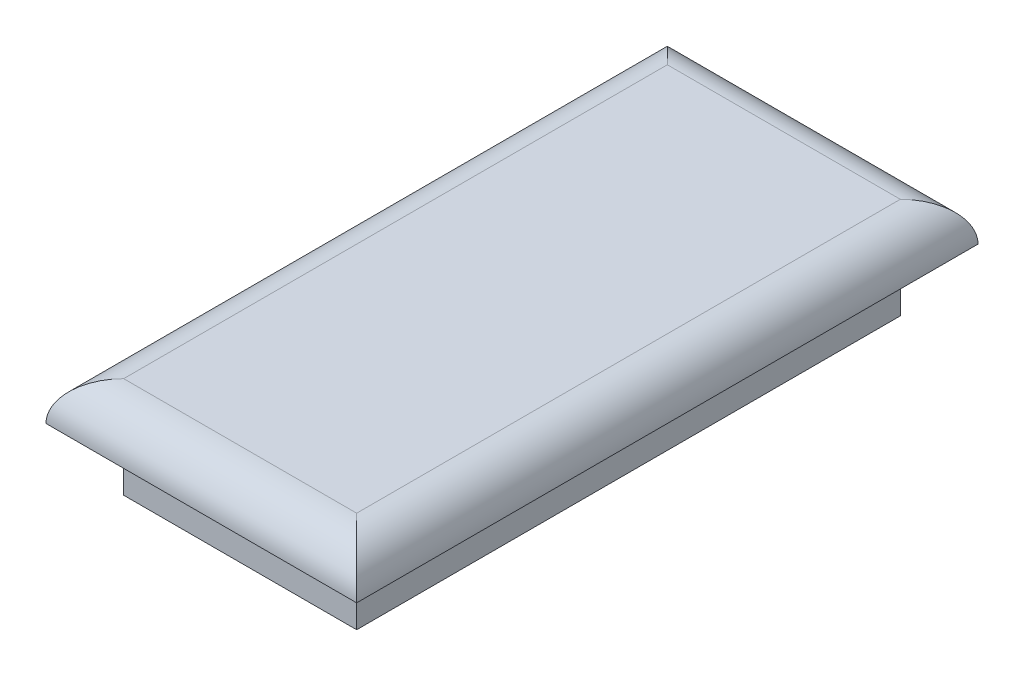
from build123d import *

# Parameters (mm, degrees)
SKETCH1_W           = 19.05
SKETCH1_H           = 44.45
BOSS_EXTRUDE1_DEPTH = 5.08
SKETCH2_W           = 25.4
SKETCH2_H           = 50.8
BOSS_EXTRUDE2_DEPTH = 3.175
FILLET1_R           = 3.175


with BuildPart() as part:
    # Sketch1 → Boss-Extrude1 (new body)
    with BuildSketch(Plane(origin=(0, 0, 0), x_dir=(1, 0, 0), z_dir=(0, 1, 0))):
        Rectangle(SKETCH1_W, SKETCH1_H)
    extrude(amount=BOSS_EXTRUDE1_DEPTH)

    # Sketch2 → Boss-Extrude2 (add)
    with BuildSketch(Plane(origin=(0, 5.08, 0), x_dir=(1, 0, 0), z_dir=(0, 1, 0))):
        Rectangle(SKETCH2_W, SKETCH2_H)
    extrude(amount=BOSS_EXTRUDE2_DEPTH)

    # Fillet1
    fillet1_edges = [part.edges().sort_by_distance(p)[0] for p in [
        (0, 8.255, -25.4),
        (-12.7, 8.255, 0),
        (0, 8.255, 25.4),
        (12.7, 8.255, 0),
    ]]
    fillet(fillet1_edges, radius=FILLET1_R - 0.0001)  # a hair under: the kernel refuses the full size


solid = part.part
